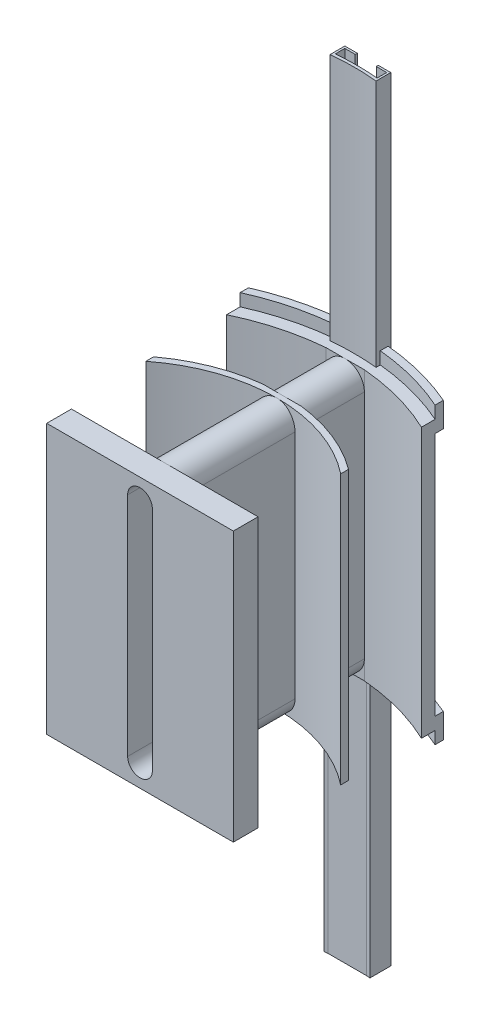
from build123d import *
from build123d.topology import SkipClean

# Parameters (mm, degrees)
BOSS_EXTRUDE1_DEPTH      = 3
BOSS_EXTRUDE2_DEPTH      = 27.25
BOSS_EXTRUDE3_START      = -32.7
BOSS_EXTRUDE3_DEPTH      = 65.4
CUT_EXTRUDE1_DEPTH       = 65.25428010078397
CUT_EXTRUDE1_DEPTH_BACK  = 65.25428010078397
CUT_EXTRUDE3_DEPTH       = 15.325997
BOSS_EXTRUDE4_START      = 6
BOSS_EXTRUDE4_DEPTH      = 6
CUT_EXTRUDE4_DEPTH       = 92.3868222640344
BOSS_EXTRUDE5_DEPTH      = 92.9
BOSS_EXTRUDE5_DEPTH_BACK = 92.9
BOSS_EXTRUDE6_DEPTH      = 60.2
BOSS_EXTRUDE7_START      = 2
BOSS_EXTRUDE7_DEPTH      = 2
BOSS_EXTRUDE8_START      = -63.199995
BOSS_EXTRUDE8_DEPTH      = 123.399995


# Read off the part's stored shape, not the designer's step: Boss-Extrude3
with BuildPart() as part:
    # Sketch1 → Boss-Extrude1 (new, symmetric)
    with BuildSketch(Plane.XY):
        Polygon((22.650000000000016, -32.699999999999996), (-22.650000000000002, -32.7), (-22.650000000000006, 32.7), (22.650000000000006, 32.70000000000001), align=None)
        with BuildLine():
            Line((2.999999999999988, 27.49999999999989), (3.0000000000000253, -27.50000000000011))
            ThreePointArc((3.0000000000000253, -27.50000000000011), (4.95e-15, -30.500000000000032), (-3.0000000000000018, -27.50000000000011))
            Line((-3.0000000000000018, -27.50000000000011), (-3.0000000000000115, 27.49999999999989))
            ThreePointArc((-3.0000000000000115, 27.49999999999989), (-2.29e-15, 30.49999999999999), (2.999999999999988, 27.49999999999989))
        make_face(mode=Mode.SUBTRACT)
    extrude(amount=BOSS_EXTRUDE1_DEPTH, both=True)

    # Sketch3 → Boss-Extrude2 (add)
    with BuildSketch(Plane(origin=(0, 0, -3), x_dir=(-1, 0, 0), z_dir=(0, 0, -1))):
        with BuildLine():
            Line((4.649999999999994, 28.05000034547939), (4.649999999999995, -28.05000067575547))
            ThreePointArc((4.649999999999995, -28.05000067575547), (4.2903809e-10, -32.70000000000004), (-4.649999999999999, -28.050000676613546))
            Line((-4.649999999999999, -28.050000676613546), (-4.6499999999999915, 28.050000344621317))
            ThreePointArc((-4.6499999999999915, 28.050000344621317), (-4.2903649e-10, 32.70000000000002), (4.649999999999994, 28.05000034547939))
        make_face()
    extrude(amount=BOSS_EXTRUDE2_DEPTH)

    # Boss-Extrude3 outline → Boss-Extrude3 (add)
    with BuildSketch(Plane(origin=(0, 0, 0), x_dir=(1, 0, 0), z_dir=(0, 1, 0)).offset(BOSS_EXTRUDE3_START)):
        with BuildLine():
            Line((4.65, 31.477081959), (4.65, 46.803079293))
            ThreePointArc((4.65, 46.803079293), (14.382164808, 45.086281989), (23.65, 41.655588809))
            Line((23.65, 41.655588809), (23.65, 44.959205999))
            ThreePointArc((23.65, 44.959205999), (0, 50), (-23.65, 44.959205999))
            Line((-23.65, 44.959205999), (-23.65, 41.655588809))
            ThreePointArc((-23.65, 41.655588809), (-14.382164808, 45.086281989), (-4.65, 46.803079293))
            Line((-4.65, 46.803079293), (-4.65, 31.477081959))
            ThreePointArc((-4.65, 31.477081959), (-14.64207711, 28.955000716), (-23.65, 23.949021894))
            Line((-23.65, 23.949021894), (-23.65, 22.06226871))
            ThreePointArc((-23.65, 22.06226871), (-12.513607029, 28.145153743), (3e-09, 30.25))
            ThreePointArc((3e-09, 30.25), (12.513607029, 28.145153743), (23.65, 22.06226871))
            Line((23.65, 22.06226871), (23.65, 23.949021894))
            ThreePointArc((23.65, 23.949021894), (14.64207711, 28.955000716), (4.65, 31.477081959))
        make_face()
    extrude(amount=BOSS_EXTRUDE3_DEPTH)

    # Sketch5 → Cut-Extrude1 (cut, two sides: drawn at the far end of the back side and taken through both)
    with BuildSketch(Plane.XY.offset(-CUT_EXTRUDE1_DEPTH_BACK)):
        with BuildLine():
            Line((3.0000000000000253, -27.50000000000011), (2.999999999999988, 27.49999999999989))
            ThreePointArc((2.999999999999988, 27.49999999999989), (-1.55e-15, 30.499999999999968), (-3.0000000000000115, 27.49999999999989))
            Line((-3.0000000000000115, 27.49999999999989), (-3.000000000000012, -27.50000000000011))
            ThreePointArc((-3.000000000000012, -27.50000000000011), (4.95e-15, -30.500000000000043), (3.0000000000000253, -27.50000000000011))
        make_face()
    extrude(amount=CUT_EXTRUDE1_DEPTH + CUT_EXTRUDE1_DEPTH_BACK, mode=Mode.SUBTRACT)

    # Sketch6 → Cut-Extrude3 (cut)
    with BuildSketch(Plane(origin=(0, 0, -31.477081959030347), x_dir=(-1, 0, 2.98e-15), z_dir=(-2.98e-15, 0, -1))):
        with BuildLine():
            Line((-4.650000000000044, 32.70000000000002), (-4.650000000000044, 28.050000344621317))
            ThreePointArc((-4.649999999999988, 28.050000344621317), (-3.2880464106754146, 31.33804665435949), (3.66e-15, 32.70000000000002))
            Line((3.55e-15, 32.70000000000002), (-4.650000000000044, 32.70000000000002))
        make_face()
        with BuildLine():
            ThreePointArc((3.72e-15, -32.70000000000004), (-3.2880462932984464, -31.338046771736472), (-4.649999999999987, -28.050000676613543))
            Line((-4.650000000000044, -28.050000676613543), (-4.650000000000044, -32.700000000000045))
            Line((-4.650000000000045, -32.70000000000004), (3.55e-15, -32.70000000000004))
        make_face()
        with BuildLine():
            Line((4.650000000000294, 32.70000000000002), (3.55e-15, 32.70000000000002))
            ThreePointArc((3.48e-15, 32.70000000000002), (3.288046410372046, 31.338046654662865), (4.6499999999999995, 28.05000034547939))
            Line((4.6500000000002935, 28.05000034547939), (4.6500000000002935, 32.70000000000002))
        make_face()
        with BuildLine():
            ThreePointArc((4.649999999999999, -28.05000067575547), (3.288046293601832, -31.338046771433103), (3.66e-15, -32.70000000000004))
            Line((3.55e-15, -32.70000000000004), (4.6500000000002935, -32.70000000000004))
            Line((4.6500000000002935, -32.700000000000045), (4.6500000000002935, -28.05000067575547))
        make_face()
    extrude(amount=CUT_EXTRUDE3_DEPTH, mode=Mode.SUBTRACT)

    # Sketch8 → Boss-Extrude4 (add)
    with BuildSketch(Plane(origin=(0, -29.700000000000042, 0), x_dir=(-1, 0, 0), z_dir=(0, -1, 0)).offset(BOSS_EXTRUDE4_START)):
        with BuildLine():
            ThreePointArc((23.650000000000016, 44.9592059985797), (3.55e-15, 50.00000000000001), (-23.65000000000001, 44.959205998579705))
            Line((-23.65000000000001, 44.959205998579705), (-23.65000000000001, 46.959205998579705))
            ThreePointArc((-23.65000000000001, 46.959205998579705), (1.2e-15, 51.90634622845455), (23.650000000000002, 46.959205998579705))
            Line((23.650000000000002, 46.959205998579705), (23.650000000000016, 44.9592059985797))
        make_face()
    boss_extrude4 = extrude(amount=-BOSS_EXTRUDE4_DEPTH)

    # Mirror1: Boss-Extrude4 across plane
    add(boss_extrude4.mirror(Plane.ZX))

    # Sketch10 → Cut-Extrude4 (cut, through all)
    with BuildSketch(Plane(origin=(0, 35.700000000000045, 0), x_dir=(1, 0, 0), z_dir=(0, 1, 0))):
        with BuildLine():
            ThreePointArc((-2.66e-15, 51.90634622845455), (-2.3894601654336958, 51.85794344375141), (-4.775000000000001, 51.71281450294779))
            Line((-4.7749999999999995, 51.71281450294779), (-4.775000000000001, 49.80310869667825))
            ThreePointArc((-4.774999999999995, 49.80310869667825), (-2.3895287812309185, 49.95075626947133), (0, 50.00000000000001))
            Line((1.2e-16, 50.00000000000001), (-1.2e-16, 51.906346228454545))
        make_face()
        with BuildLine():
            ThreePointArc((4.7749999999999995, 51.71281450294779), (2.389460165433687, 51.85794344375141), (-2.66e-15, 51.90634622845455))
            Line((-1.2e-16, 51.906346228454545), (1.2e-16, 50.00000000000001))
            ThreePointArc((0, 50.00000000000001), (2.3895287812309185, 49.95075626947132), (4.775000000000002, 49.80310869667826))
            Line((4.775000000000001, 49.80310869667825), (4.7749999999999995, 51.71281450294779))
        make_face()
        with BuildLine():
            ThreePointArc((-4.775000000000001, 51.71281450294779), (-4.925016026639422, 51.700441497156774), (-5.0750000000000055, 51.68768582171582))
            Line((-5.075000000000002, 51.6876858217158), (-5.075000000000002, 49.777542133600676))
            ThreePointArc((-5.075000000000003, 49.777542133600676), (-4.925016590051946, 49.79052008407359), (-4.774999999999995, 49.80310869667825))
            Line((-4.775000000000001, 49.80310869667825), (-4.7749999999999995, 51.71281450294779))
        make_face()
        with BuildLine():
            ThreePointArc((5.075, 51.68768582171582), (4.92501602663942, 51.700441497156774), (4.7749999999999995, 51.71281450294779))
            Line((4.7749999999999995, 51.71281450294779), (4.775000000000001, 49.80310869667825))
            ThreePointArc((4.775000000000002, 49.80310869667826), (4.925016590051946, 49.79052008407359), (5.075000000000006, 49.77754213360067))
            Line((5.075000000000002, 49.777542133600676), (5.075000000000002, 51.6876858217158))
        make_face()
    extrude(amount=-CUT_EXTRUDE4_DEPTH, mode=Mode.SUBTRACT)

    # Sketch11 → Boss-Extrude5 (add, two sides: drawn at the far end of the back side and taken through both)
    with BuildSketch(Plane(origin=(0, 0, 0), x_dir=(1, 0, 0), z_dir=(0, 1, 0)).offset(-BOSS_EXTRUDE5_DEPTH_BACK)):
        with BuildLine():
            ThreePointArc((-5.575000000000004, 49.73144182332538), (-5.325049887996534, 49.75503305938237), (-5.075000000000003, 49.77754213360069))
            Line((-5.075000000000003, 49.77754213360068), (-5.075000000000002, 51.787685821715804))
            Line((-5.075000000000002, 51.787685821715804), (-2.55, 51.787685821715804))
            Line((-2.55, 51.787685821715804), (-2.55, 52.287685821715804))
            Line((-2.55, 52.287685821715804), (-5.575000000000002, 52.287685821715804))
            Line((-5.575000000000002, 52.287685821715804), (-5.575000000000002, 49.731441823325355))
        make_face()
        with BuildLine():
            ThreePointArc((5.075, 49.777542133600676), (5.325049887996536, 49.75503305938236), (5.575000000000004, 49.73144182332537))
            Line((5.575000000000002, 49.731441823325355), (5.575000000000002, 52.287685821715804))
            Line((5.575000000000002, 52.287685821715804), (2.55, 52.287685821715804))
            Line((2.55, 52.287685821715804), (2.55, 51.787685821715804))
            Line((2.55, 51.787685821715804), (5.075000000000002, 51.787685821715804))
            Line((5.075000000000002, 51.787685821715804), (5.075000000000002, 49.77754213360068))
        make_face()
    extrude(amount=BOSS_EXTRUDE5_DEPTH + BOSS_EXTRUDE5_DEPTH_BACK)

    # Sketch13 → Boss-Extrude6 (add)
    with BuildSketch(Plane(origin=(0, -92.9, 0), x_dir=(-1, 0, 0), z_dir=(0, -1, 0))):
        with BuildLine():
            ThreePointArc((-5.075000000000002, 49.777542133600676), (-5.325049887996533, 49.75503305938237), (-5.575000000000003, 49.73144182332537))
            Line((-5.575000000000002, 49.731441823325355), (-5.575, 47.21928444846058))
            ThreePointArc((-5.574999999999999, 47.21928444846057), (-5.123234458936481, 47.26302985431368), (-4.671126278206678, 47.30307929304702))
            Line((-4.671126278206679, 47.30307929304703), (4.974e-14, 47.30307929304701))
            Line((4.94e-14, 47.30307929304701), (4.671126278206844, 47.30307929304701))
            ThreePointArc((4.671126278206842, 47.30307929304702), (5.123234458936562, 47.263029854313686), (5.574999999999999, 47.21928444846057))
            Line((5.575000000000002, 47.21928444846058), (5.575000000000002, 49.731441823325355))
            ThreePointArc((5.5750000000000055, 49.73144182332537), (5.3250498879965305, 49.755033059382356), (5.0750000000000055, 49.77754213360069))
            ThreePointArc((5.075000000000002, 49.777542133600676), (0, 50.00000000000001), (-5.075000000000002, 49.77754213360068))
        make_face()
    extrude(amount=-BOSS_EXTRUDE6_DEPTH)

    # Sketch14 → Boss-Extrude7 (add)
    with BuildSketch(Plane(origin=(0, -92.9, 0), x_dir=(-1, 0, 0), z_dir=(0, -1, 0)).offset(BOSS_EXTRUDE7_START)):
        with BuildLine():
            Line((-2.55, 52.287685821715804), (2.55, 52.287685821715804))
            Line((2.55, 52.287685821715804), (5.575000000000002, 52.287685821715804))
            Line((5.575000000000002, 52.287685821715804), (5.575000000000002, 47.21928444846058))
            ThreePointArc((5.575000000000002, 47.21928444846058), (5.123234458936565, 47.26302985431368), (4.671126278206844, 47.30307929304701))
            Line((4.671126278206844, 47.30307929304701), (-4.6711262782066765, 47.30307929304702))
            ThreePointArc((-4.6711262782066765, 47.30307929304702), (-5.123234458936484, 47.26302985431368), (-5.575, 47.21928444846058))
            Line((-5.575, 47.21928444846058), (-5.575000000000002, 52.287685821715804))
            Line((-5.575000000000002, 52.287685821715804), (-2.55, 52.287685821715804))
        make_face()
    extrude(amount=-BOSS_EXTRUDE7_DEPTH)

    # Sketch15 → Boss-Extrude8 (add)
    with SkipClean():  # the faces are left unmerged after this step: merging them gives an invalid solid
        with BuildSketch(Plane(origin=(0, 32.70000000000002, 0), x_dir=(1, 0, 0), z_dir=(0, 1, 0)).offset(BOSS_EXTRUDE8_START)):
            with BuildLine():
                ThreePointArc((-5.075, 49.77754213360067), (-5.325049887996525, 49.75503305938235), (-5.575000000000001, 49.731441823325355))
                Line((-5.575000000000003, 49.73144182332537), (-5.575000000000002, 48.726707775085984))
                ThreePointArc((-5.575000000000004, 48.72670777508598), (3.49e-15, 49), (5.574999999999998, 48.72670777508598))
                Line((5.575000000000002, 48.726707775085984), (5.575000000000002, 49.731441823325355))
                ThreePointArc((5.575000000000009, 49.731441823325355), (5.325049887996532, 49.75503305938235), (5.074999999999995, 49.77754213360067))
                Line((5.075000000000002, 49.777542133600676), (5.075000000000002, 49.47638101864104))
                ThreePointArc((5.075000000000003, 49.47638101864105), (1.78e-15, 49.70000000000001), (-5.074999999999999, 49.47638101864104))
                Line((-5.075000000000002, 49.47638101864104), (-5.075000000000002, 49.777542133600676))
            make_face()
        boss_extrude8 = extrude(amount=BOSS_EXTRUDE8_DEPTH)

    # Mirror2: Boss-Extrude8 across plane
    add(boss_extrude8.mirror(Plane.ZX))


solid = part.part
